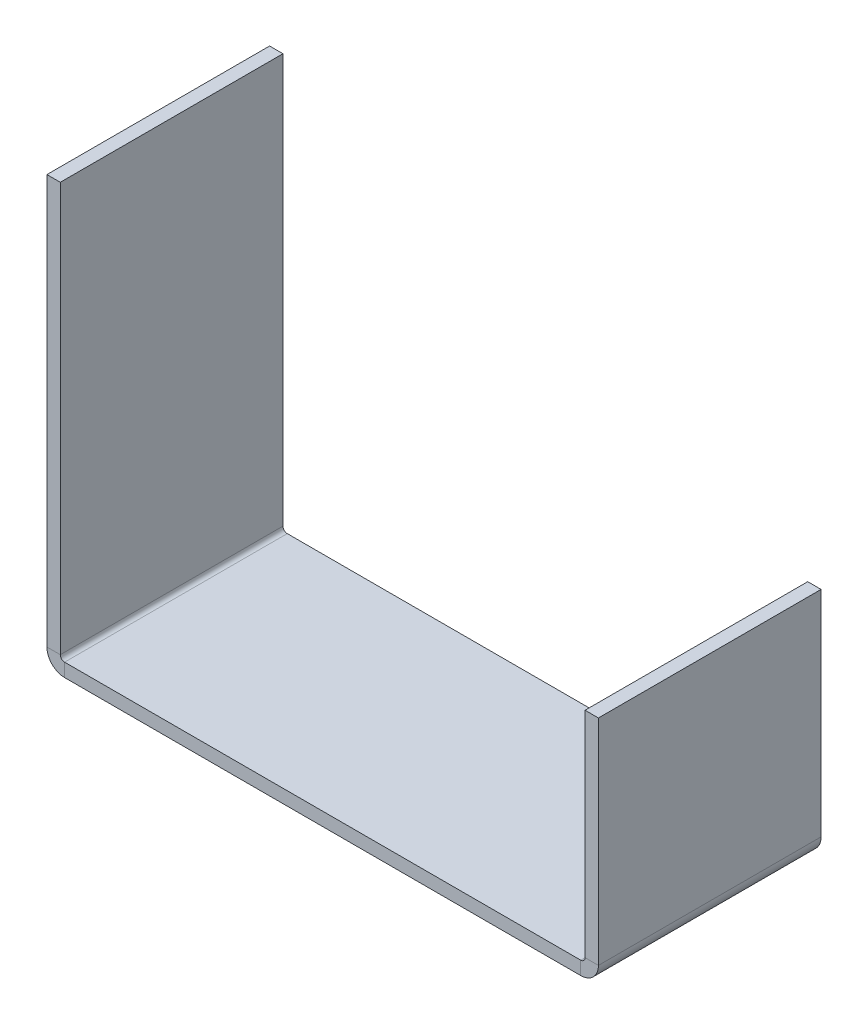
from build123d import *

# Parameters (mm, degrees)
SKETCH1_W                    = 94.361
SKETCH1_H                    = 38.1
BASE_FLANGE1_DEPTH           = 2.286
EDGE_FLANGE1_STRIP_W         = 10.6172
EDGE_FLANGE1_STRIP_H         = 2.286
EDGE_FLANGE1_STRIP_CUT_DEPTH = 38.1
EDGE_FLANGE1_DEPTH           = 38.1
EDGE_FLANGE2_STRIP_W         = 10.6172
EDGE_FLANGE2_STRIP_H         = 2.286
EDGE_FLANGE2_STRIP_CUT_DEPTH = 38.1
EDGE_FLANGE2_DEPTH           = 38.1


# Sheet-metal steps are written as plain solids
with BuildPart() as part:
    # Sketch1 → Base-Flange1 (new body)
    with BuildSketch(Plane(origin=(0, 0, 0), x_dir=(1, 0, 0), z_dir=(0, 1, 0))):
        Rectangle(SKETCH1_W, SKETCH1_H)
    extrude(amount=-BASE_FLANGE1_DEPTH)

    # Edge-Flange1 strip (across the edge) → Edge-Flange1 strip cut (cut)
    with BuildSketch(Plane(origin=(47.1805, 0, 19.05), x_dir=(-1, 0, 0), z_dir=(0, 0, -1))):
        with Locations((-2.286, -1.143)):
            Rectangle(EDGE_FLANGE1_STRIP_W, EDGE_FLANGE1_STRIP_H)
    extrude(amount=EDGE_FLANGE1_STRIP_CUT_DEPTH, mode=Mode.SUBTRACT)

    # Edge-Flange1 section (across the edge) → Edge-Flange1 (add)
    with BuildSketch(Plane(origin=(47.1805, 0, 19.05), x_dir=(-1, 0, 0), z_dir=(0, 0, -1))):
        with BuildLine():
            Line((0, 0.7366), (0, 37.4015))
            Line((0, 37.4015), (2.286, 37.4015))
            Line((2.286, 37.4015), (2.286, 0.7366))
            ThreePointArc((2.286, 0.7366), (2.501745145, 0.215745145), (3.0226, 0))
            Line((3.0226, 0), (3.0226, -2.286))
            ThreePointArc((3.0226, -2.286), (0.885299043, -1.400700957), (0, 0.7366))
        make_face()
    extrude(amount=EDGE_FLANGE1_DEPTH)

    # Edge-Flange2 strip (across the edge) → Edge-Flange2 strip cut (cut)
    with BuildSketch(Plane(origin=(-47.1805, 0, -19.05), x_dir=(1, 0, 0), z_dir=(0, 0, 1))):
        with Locations((-2.286, -1.143)):
            Rectangle(EDGE_FLANGE2_STRIP_W, EDGE_FLANGE2_STRIP_H)
    extrude(amount=EDGE_FLANGE2_STRIP_CUT_DEPTH, mode=Mode.SUBTRACT)

    # Edge-Flange2 section (across the edge) → Edge-Flange2 (add)
    with BuildSketch(Plane(origin=(-47.1805, 0, -19.05), x_dir=(1, 0, 0), z_dir=(0, 0, 1))):
        with BuildLine():
            Line((0, 0.7366), (0, 70.739))
            Line((0, 70.739), (2.286, 70.739))
            Line((2.286, 70.739), (2.286, 0.7366))
            ThreePointArc((2.286, 0.7366), (2.501745145, 0.215745145), (3.0226, 0))
            Line((3.0226, 0), (3.0226, -2.286))
            ThreePointArc((3.0226, -2.286), (0.885299043, -1.400700957), (0, 0.7366))
        make_face()
    extrude(amount=EDGE_FLANGE2_DEPTH)


solid = part.part
